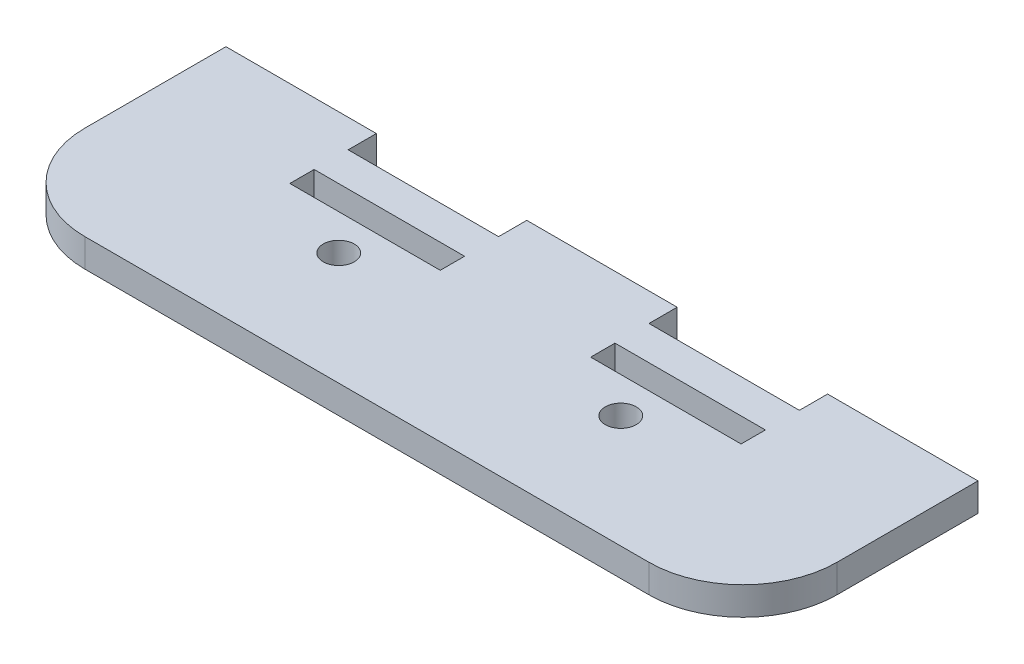
from build123d import *

# Parameters (mm, degrees)
SKETCH1_R           = 1.65
SKETCH1_W           = 16
SKETCH1_H           = 2.586246341
BOSS_EXTRUDE1_DEPTH = 3


with BuildPart() as part:
    # Sketch1 → Boss-Extrude1 (new body)
    with BuildSketch(Plane(origin=(0, 0, 0), x_dir=(1, 0, 0), z_dir=(0, 1, 0))):
        with BuildLine():
            Line((30, -12.5), (-30, -12.5))
            ThreePointArc((-30, -12.5), (-37.071067812, -9.571067812), (-40, -2.5))
            Line((-40, -2.5), (-40, 12.5))
            Line((-40, 12.5), (-24, 12.5))
            Line((-24, 12.5), (-24, 9.5))
            Line((-24, 9.5), (-8, 9.5))
            Line((-8, 9.5), (-8, 12.5))
            Line((-8, 12.5), (8, 12.5))
            Line((8, 12.5), (8, 9.5))
            Line((8, 9.5), (24, 9.5))
            Line((24, 9.5), (24, 12.5))
            Line((24, 12.5), (40, 12.5))
            Line((40, 12.5), (40, -2.5))
            ThreePointArc((40, -2.5), (37.071067812, -9.571067812), (30, -12.5))
        make_face()
        with Locations((-15, -0.5)):
            Circle(SKETCH1_R, mode=Mode.SUBTRACT)
        with Locations((15, -0.5)):
            Circle(SKETCH1_R, mode=Mode.SUBTRACT)
        with Locations((-16, 4.590423815)):
            Rectangle(SKETCH1_W, SKETCH1_H, mode=Mode.SUBTRACT)
        with Locations((16, 4.590423815)):
            Rectangle(SKETCH1_W, SKETCH1_H, mode=Mode.SUBTRACT)
    extrude(amount=BOSS_EXTRUDE1_DEPTH)


solid = part.part
